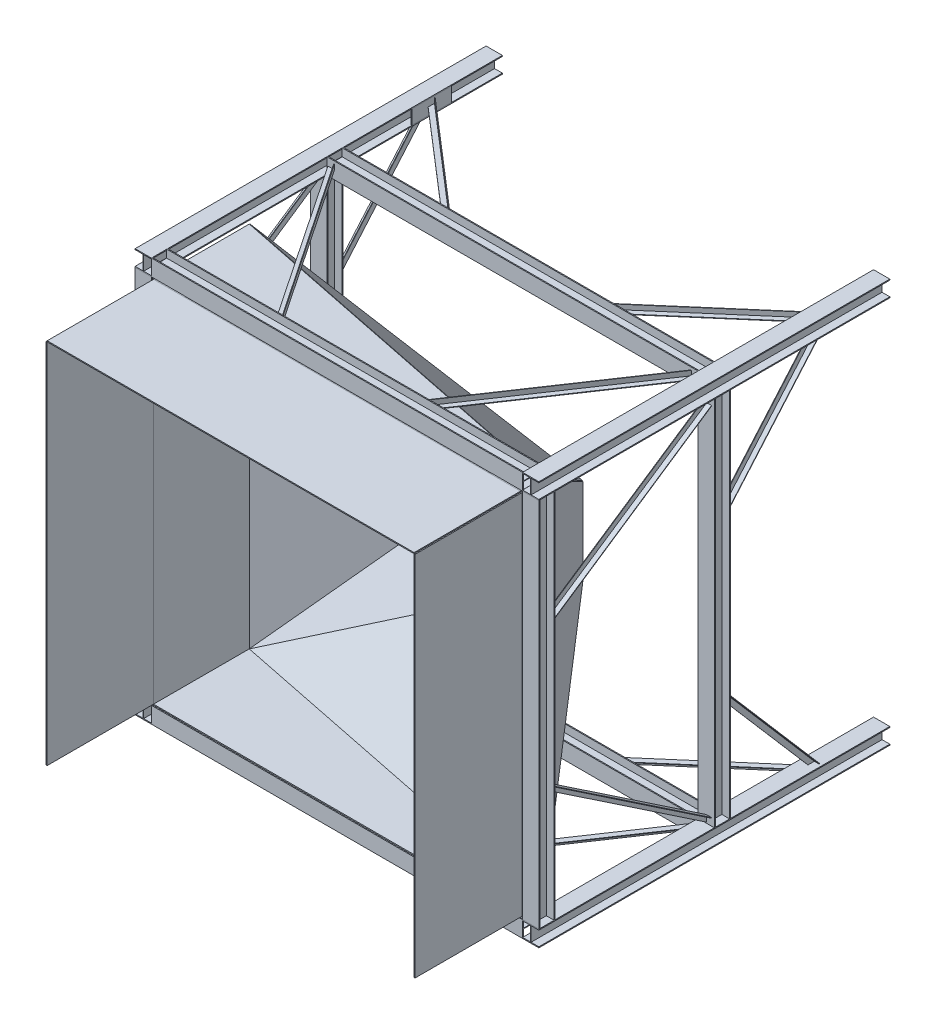
from build123d import *

# Parameters (mm, degrees)
COLUMNA_H_1_DEPTH                            = 3300
COLUMNA_H_2_DEPTH                            = 3300
COLUMNA_H_3_DEPTH                            = 3300
COLUMNA_H_4_DEPTH                            = 3300
VIGA_H_CARGA_1650_DEPTH                      = 3490
VIGA_H_CARGA_3300_DEPTH                      = 3490
CONTORNO_CIERRE_COLUMNA_CARGA_A_W            = 370
CONTORNO_CIERRE_COLUMNA_CARGA_A_H            = 135
CIERRE_COLUMNA_CARGA_A_DEPTH                 = 8
ALA_PLANA_ANGULAR_SUPERIOR_CARGA_A_DEPTH     = 5
RETORNO_ANGULAR_SUPERIOR_CARGA_A_DEPTH       = 45
ALA_PLANA_ANGULAR_INFERIOR_CARGA_A_DEPTH     = 5
RETORNO_ANGULAR_INFERIOR_CARGA_A_DEPTH       = 45
CONTORNO_CIERRE_COLUMNA_CARGA_B_W            = 370
CONTORNO_CIERRE_COLUMNA_CARGA_B_H            = 135
CIERRE_COLUMNA_CARGA_B_DEPTH                 = 8
ALA_PLANA_ANGULAR_SUPERIOR_CARGA_B_DEPTH     = 5
RETORNO_ANGULAR_SUPERIOR_CARGA_B_DEPTH       = 45
ALA_PLANA_ANGULAR_INFERIOR_CARGA_B_DEPTH     = 5
RETORNO_ANGULAR_INFERIOR_CARGA_B_DEPTH       = 45
CONTORNO_ASIENTO_SOLDADO_CARGA_W             = 2900
CONTORNO_ASIENTO_SOLDADO_CARGA_H             = 83.725
ASIENTO_SOLDADO_CARGA_DEPTH                  = 9.525
VIGA_H_FONDO_1650_DEPTH                      = 3490
VIGA_H_FONDO_3300_DEPTH                      = 3490
CONTORNO_CIERRE_COLUMNA_FONDO_A_W            = 370
CONTORNO_CIERRE_COLUMNA_FONDO_A_H            = 135
CIERRE_COLUMNA_FONDO_A_DEPTH                 = 8
ALA_PLANA_ANGULAR_SUPERIOR_FONDO_A_DEPTH     = 5
RETORNO_ANGULAR_SUPERIOR_FONDO_A_DEPTH       = 45
ALA_PLANA_ANGULAR_INFERIOR_FONDO_A_DEPTH     = 5
RETORNO_ANGULAR_INFERIOR_FONDO_A_DEPTH       = 45
CONTORNO_CIERRE_COLUMNA_FONDO_B_W            = 370
CONTORNO_CIERRE_COLUMNA_FONDO_B_H            = 135
CIERRE_COLUMNA_FONDO_B_DEPTH                 = 8
ALA_PLANA_ANGULAR_SUPERIOR_FONDO_B_DEPTH     = 5
RETORNO_ANGULAR_SUPERIOR_FONDO_B_DEPTH       = 45
ALA_PLANA_ANGULAR_INFERIOR_FONDO_B_DEPTH     = 5
RETORNO_ANGULAR_INFERIOR_FONDO_B_DEPTH       = 45
CONTORNO_ASIENTO_SOLDADO_FONDO_W             = 2900
CONTORNO_ASIENTO_SOLDADO_FONDO_H             = 83.725
ASIENTO_SOLDADO_FONDO_DEPTH                  = 9.525
VIGA_H_IZQUIERDA_1650_DEPTH                  = 3490
VIGA_H_IZQUIERDA_3300_DEPTH                  = 3490
ALA_PLANA_ANGULAR_SUPERIOR_IZQUIERDA_A_DEPTH = 5
RETORNO_ANGULAR_SUPERIOR_IZQUIERDA_A_DEPTH   = 45
ALA_PLANA_ANGULAR_INFERIOR_IZQUIERDA_A_DEPTH = 5
RETORNO_ANGULAR_INFERIOR_IZQUIERDA_A_DEPTH   = 45
ALA_PLANA_ANGULAR_SUPERIOR_IZQUIERDA_B_DEPTH = 5
RETORNO_ANGULAR_SUPERIOR_IZQUIERDA_B_DEPTH   = 45
ALA_PLANA_ANGULAR_INFERIOR_IZQUIERDA_B_DEPTH = 5
RETORNO_ANGULAR_INFERIOR_IZQUIERDA_B_DEPTH   = 45
CONTORNO_ASIENTO_SOLDADO_IZQUIERDA_W         = 83.725
CONTORNO_ASIENTO_SOLDADO_IZQUIERDA_H         = 2900
ASIENTO_SOLDADO_IZQUIERDA_DEPTH              = 9.525
VIGA_H_DERECHA_1650_DEPTH                    = 3490
VIGA_H_DERECHA_3300_DEPTH                    = 3490
ALA_PLANA_ANGULAR_SUPERIOR_DERECHA_A_DEPTH   = 5
RETORNO_ANGULAR_SUPERIOR_DERECHA_A_DEPTH     = 45
ALA_PLANA_ANGULAR_INFERIOR_DERECHA_A_DEPTH   = 5
RETORNO_ANGULAR_INFERIOR_DERECHA_A_DEPTH     = 45
ALA_PLANA_ANGULAR_SUPERIOR_DERECHA_B_DEPTH   = 5
RETORNO_ANGULAR_SUPERIOR_DERECHA_B_DEPTH     = 45
ALA_PLANA_ANGULAR_INFERIOR_DERECHA_B_DEPTH   = 5
RETORNO_ANGULAR_INFERIOR_DERECHA_B_DEPTH     = 45
CONTORNO_ASIENTO_SOLDADO_DERECHA_W           = 83.725
CONTORNO_ASIENTO_SOLDADO_DERECHA_H           = 2900
ASIENTO_SOLDADO_DERECHA_DEPTH                = 9.525
COLLAR_CARGA_DEPTH                           = 9.525
EMBUDO_CARGA_PA_O_SUPERIOR_DEPTH             = 9.525
EMBUDO_CARGA_PA_O_INFERIOR_DEPTH             = 9.525
CONTORNO_COLLAR_DERECHA_W                    = 200
CONTORNO_COLLAR_DERECHA_H                    = 3450
COLLAR_DERECHA_DEPTH                         = 9.525
CONTORNO_ALER_N_DERECHA_W                    = 1000
CONTORNO_ALER_N_DERECHA_H                    = 3450
ALER_N_DERECHA_DEPTH                         = 9.525
EMBUDO_DERECHA_DEPTH                         = 9.525
COLLAR_FONDO_DEPTH                           = 9.525
CONTORNO_ALER_N_FONDO_W                      = 3450
CONTORNO_ALER_N_FONDO_H                      = 1000
ALER_N_FONDO_DEPTH                           = 9.525
EMBUDO_FONDO_PA_O_SUPERIOR_DEPTH             = 9.525
EMBUDO_FONDO_PA_O_INFERIOR_DEPTH             = 9.525
CONTORNO_COLLAR_IZQUIERDA_W                  = 900
CONTORNO_COLLAR_IZQUIERDA_H                  = 3450
COLLAR_IZQUIERDA_DEPTH                       = 9.525
CONTORNO_ALER_N_IZQUIERDA_W                  = 1000
CONTORNO_ALER_N_IZQUIERDA_H                  = 3450
ALER_N_IZQUIERDA_DEPTH                       = 9.525
EMBUDO_IZQUIERDA_DEPTH                       = 9.525


with BuildPart() as part:
    # Contorno Columna H 1 → Columna H 1 (new body)
    with BuildSketch(Plane.XY):
        Polygon((-1898, -1898), (-1745, -1898), (-1745, -1889), (-1818.25, -1889), (-1818.25, -1754), (-1745, -1754), (-1745, -1745), (-1898, -1745), (-1898, -1754), (-1824.75, -1754), (-1824.75, -1889), (-1898, -1889), align=None)
    extrude(amount=COLUMNA_H_1_DEPTH)


with BuildPart() as body_2:
    # Contorno Columna H 2 → Columna H 2 (new body)
    with BuildSketch(Plane.XY):
        Polygon((-1898, 1745), (-1745, 1745), (-1745, 1754), (-1818.25, 1754), (-1818.25, 1889), (-1745, 1889), (-1745, 1898), (-1898, 1898), (-1898, 1889), (-1824.75, 1889), (-1824.75, 1754), (-1898, 1754), align=None)
    extrude(amount=COLUMNA_H_2_DEPTH)


with BuildPart() as body_3:
    # Contorno Columna H 3 → Columna H 3 (new body)
    with BuildSketch(Plane.XY):
        Polygon((1745, -1898), (1898, -1898), (1898, -1889), (1824.75, -1889), (1824.75, -1754), (1898, -1754), (1898, -1745), (1745, -1745), (1745, -1754), (1818.25, -1754), (1818.25, -1889), (1745, -1889), align=None)
    extrude(amount=COLUMNA_H_3_DEPTH)


with BuildPart() as body_4:
    # Contorno Columna H 4 → Columna H 4 (new body)
    with BuildSketch(Plane.XY):
        Polygon((1745, 1745), (1898, 1745), (1898, 1754), (1824.75, 1754), (1824.75, 1889), (1898, 1889), (1898, 1898), (1745, 1898), (1745, 1889), (1818.25, 1889), (1818.25, 1754), (1745, 1754), align=None)
    extrude(amount=COLUMNA_H_4_DEPTH)


with BuildPart() as body_5:
    # Contorno Viga H carga 1650 → Viga H carga 1650 (new body)
    with BuildSketch(Plane(origin=(-1745, 0, 0), x_dir=(0, 0, -1), z_dir=(1, 0, 0))):
        Polygon((-1497, -1745), (-1497, -1898), (-1506, -1898), (-1506, -1824.75), (-1641, -1824.75), (-1641, -1898), (-1650, -1898), (-1650, -1745), (-1641, -1745), (-1641, -1818.25), (-1506, -1818.25), (-1506, -1745), align=None)
    extrude(amount=VIGA_H_CARGA_1650_DEPTH)


with BuildPart() as body_6:
    # Contorno Viga H carga 3300 → Viga H carga 3300 (new body)
    with BuildSketch(Plane(origin=(-1745, 0, 0), x_dir=(0, 0, -1), z_dir=(1, 0, 0))):
        Polygon((-3147, -1745), (-3147, -1898), (-3156, -1898), (-3156, -1824.75), (-3291, -1824.75), (-3291, -1898), (-3300, -1898), (-3300, -1745), (-3291, -1745), (-3291, -1818.25), (-3156, -1818.25), (-3156, -1745), align=None)
    extrude(amount=VIGA_H_CARGA_3300_DEPTH)


with BuildPart() as body_7:
    # Contorno Cierre columna carga A → Cierre columna carga A (new body)
    with BuildSketch(Plane(origin=(-1745, 0, 0), x_dir=(0, 0, -1), z_dir=(1, 0, 0))):
        with Locations((-665, -1821.5)):
            Rectangle(CONTORNO_CIERRE_COLUMNA_CARGA_A_W, CONTORNO_CIERRE_COLUMNA_CARGA_A_H)
    extrude(amount=-CIERRE_COLUMNA_CARGA_A_DEPTH)


with BuildPart() as body_8:
    # Contorno Ala plana Angular superior carg → Ala plana Angular superior carga A (new body)
    with BuildSketch(Plane(origin=(0, -1821.5, 0), x_dir=(1, 0, 0), z_dir=(0, 1, 0))):
        Polygon((-1674.870108064, -1650), (-1735.129891936, -1650), (-728.129891936, -3147), (-667.870108064, -3147), align=None)
    extrude(amount=-ALA_PLANA_ANGULAR_SUPERIOR_CARGA_A_DEPTH)


with BuildPart() as body_9:
    # Contorno Retorno Angular superior carga → Retorno Angular superior carga A (new body)
    with BuildSketch(Plane(origin=(0, -1826.5, 0), x_dir=(1, 0, 0), z_dir=(0, 1, 0))):
        Polygon((-1674.870108064, -1650), (-1680.896086451, -1650), (-673.896086451, -3147), (-667.870108064, -3147), align=None)
    extrude(amount=-RETORNO_ANGULAR_SUPERIOR_CARGA_A_DEPTH)


with BuildPart() as body_8_1:
    add(body_8.part)

    # Angular superior carga A: union body 9
    add(body_9.part)


with BuildPart() as body_9_2:
    # Contorno Ala plana Angular inferior carg → Ala plana Angular inferior carga A (new body)
    with BuildSketch(Plane(origin=(0, -1821.5, 0), x_dir=(1, 0, 0), z_dir=(0, 1, 0))):
        Polygon((-1745, -631.991026401), (-1745, -698.008973599), (-818.285648465, -1497), (-741.714351535, -1497), align=None)
    extrude(amount=-ALA_PLANA_ANGULAR_INFERIOR_CARGA_A_DEPTH)


with BuildPart() as body_10:
    # Contorno Retorno Angular inferior carga → Retorno Angular inferior carga A (new body)
    with BuildSketch(Plane(origin=(0, -1826.5, 0), x_dir=(1, 0, 0), z_dir=(0, 1, 0))):
        Polygon((-1745, -631.991026401), (-1745, -638.592821121), (-749.371481228, -1497), (-741.714351535, -1497), align=None)
    extrude(amount=-RETORNO_ANGULAR_INFERIOR_CARGA_A_DEPTH)


with BuildPart() as body_9_2_1:
    add(body_9_2.part)

    # Angular inferior carga A: union body 10
    add(body_10.part)


with BuildPart() as body_10_2:
    # Contorno Cierre columna carga B → Cierre columna carga B (new body)
    with BuildSketch(Plane(origin=(1745, 0, 0), x_dir=(0, 0, -1), z_dir=(1, 0, 0))):
        with Locations((-665, -1821.5)):
            Rectangle(CONTORNO_CIERRE_COLUMNA_CARGA_B_W, CONTORNO_CIERRE_COLUMNA_CARGA_B_H)
    extrude(amount=CIERRE_COLUMNA_CARGA_B_DEPTH)


with BuildPart() as body_11:
    # Contorno Ala plana Angular superior  2 → Ala plana Angular superior carga B (new body)
    with BuildSketch(Plane(origin=(0, -1821.5, 0), x_dir=(1, 0, 0), z_dir=(0, 1, 0))):
        Polygon((1674.870108064, -1650), (1735.129891936, -1650), (728.129891936, -3147), (667.870108064, -3147), align=None)
    extrude(amount=-ALA_PLANA_ANGULAR_SUPERIOR_CARGA_B_DEPTH)


with BuildPart() as body_12:
    # Contorno Retorno Angular superior ca 2 → Retorno Angular superior carga B (new body)
    with BuildSketch(Plane(origin=(0, -1826.5, 0), x_dir=(1, 0, 0), z_dir=(0, 1, 0))):
        Polygon((1674.870108064, -1650), (1680.896086451, -1650), (673.896086451, -3147), (667.870108064, -3147), align=None)
    extrude(amount=-RETORNO_ANGULAR_SUPERIOR_CARGA_B_DEPTH)


with BuildPart() as body_11_1:
    add(body_11.part)

    # Angular superior carga B: union body 12
    add(body_12.part)


with BuildPart() as body_12_2:
    # Contorno Ala plana Angular inferior  2 → Ala plana Angular inferior carga B (new body)
    with BuildSketch(Plane(origin=(0, -1821.5, 0), x_dir=(1, 0, 0), z_dir=(0, 1, 0))):
        Polygon((1745, -631.991026401), (1745, -698.008973599), (818.285648465, -1497), (741.714351535, -1497), align=None)
    extrude(amount=-ALA_PLANA_ANGULAR_INFERIOR_CARGA_B_DEPTH)


with BuildPart() as body_13:
    # Contorno Retorno Angular inferior ca 2 → Retorno Angular inferior carga B (new body)
    with BuildSketch(Plane(origin=(0, -1826.5, 0), x_dir=(1, 0, 0), z_dir=(0, 1, 0))):
        Polygon((1745, -631.991026401), (1745, -638.592821121), (749.371481228, -1497), (741.714351535, -1497), align=None)
    extrude(amount=-RETORNO_ANGULAR_INFERIOR_CARGA_B_DEPTH)


with BuildPart() as body_12_2_1:
    add(body_12_2.part)

    # Angular inferior carga B: union body 13
    add(body_13.part)


with BuildPart() as body_13_2:
    # Contorno Asiento soldado carga → Asiento soldado carga (new body)
    with BuildSketch(Plane.XY.offset(3281.475)):
        with Locations((0, -1776.3875)):
            Rectangle(CONTORNO_ASIENTO_SOLDADO_CARGA_W, CONTORNO_ASIENTO_SOLDADO_CARGA_H)
    extrude(amount=ASIENTO_SOLDADO_CARGA_DEPTH)


with BuildPart() as body_14:
    # Contorno Viga H fondo 1650 → Viga H fondo 1650 (new body)
    with BuildSketch(Plane(origin=(-1745, 0, 0), x_dir=(0, 0, -1), z_dir=(1, 0, 0))):
        Polygon((-1497, 1745), (-1497, 1898), (-1506, 1898), (-1506, 1824.75), (-1641, 1824.75), (-1641, 1898), (-1650, 1898), (-1650, 1745), (-1641, 1745), (-1641, 1818.25), (-1506, 1818.25), (-1506, 1745), align=None)
    extrude(amount=VIGA_H_FONDO_1650_DEPTH)


with BuildPart() as body_15:
    # Contorno Viga H fondo 3300 → Viga H fondo 3300 (new body)
    with BuildSketch(Plane(origin=(-1745, 0, 0), x_dir=(0, 0, -1), z_dir=(1, 0, 0))):
        Polygon((-3147, 1745), (-3147, 1898), (-3156, 1898), (-3156, 1824.75), (-3291, 1824.75), (-3291, 1898), (-3300, 1898), (-3300, 1745), (-3291, 1745), (-3291, 1818.25), (-3156, 1818.25), (-3156, 1745), align=None)
    extrude(amount=VIGA_H_FONDO_3300_DEPTH)


with BuildPart() as body_16:
    # Contorno Cierre columna fondo A → Cierre columna fondo A (new body)
    with BuildSketch(Plane(origin=(-1745, 0, 0), x_dir=(0, 0, -1), z_dir=(1, 0, 0))):
        with Locations((-665, 1821.5)):
            Rectangle(CONTORNO_CIERRE_COLUMNA_FONDO_A_W, CONTORNO_CIERRE_COLUMNA_FONDO_A_H)
    extrude(amount=-CIERRE_COLUMNA_FONDO_A_DEPTH)


with BuildPart() as body_17:
    # Contorno Ala plana Angular superior fond → Ala plana Angular superior fondo A (new body)
    with BuildSketch(Plane(origin=(0, 1821.5, 0), x_dir=(1, 0, 0), z_dir=(0, 1, 0))):
        Polygon((-1674.870108064, -1650), (-1735.129891936, -1650), (-728.129891936, -3147), (-667.870108064, -3147), align=None)
    extrude(amount=ALA_PLANA_ANGULAR_SUPERIOR_FONDO_A_DEPTH)


with BuildPart() as body_18:
    # Contorno Retorno Angular superior fondo → Retorno Angular superior fondo A (new body)
    with BuildSketch(Plane(origin=(0, 1826.5, 0), x_dir=(1, 0, 0), z_dir=(0, 1, 0))):
        Polygon((-1674.870108064, -1650), (-1680.896086451, -1650), (-673.896086451, -3147), (-667.870108064, -3147), align=None)
    extrude(amount=RETORNO_ANGULAR_SUPERIOR_FONDO_A_DEPTH)


with BuildPart() as body_17_1:
    add(body_17.part)

    # Angular superior fondo A: union body 18
    add(body_18.part)


with BuildPart() as body_18_2:
    # Contorno Ala plana Angular inferior fond → Ala plana Angular inferior fondo A (new body)
    with BuildSketch(Plane(origin=(0, 1821.5, 0), x_dir=(1, 0, 0), z_dir=(0, 1, 0))):
        Polygon((-1745, -631.991026401), (-1745, -698.008973599), (-818.285648465, -1497), (-741.714351535, -1497), align=None)
    extrude(amount=ALA_PLANA_ANGULAR_INFERIOR_FONDO_A_DEPTH)


with BuildPart() as body_19:
    # Contorno Retorno Angular inferior fondo → Retorno Angular inferior fondo A (new body)
    with BuildSketch(Plane(origin=(0, 1826.5, 0), x_dir=(1, 0, 0), z_dir=(0, 1, 0))):
        Polygon((-1745, -631.991026401), (-1745, -638.592821121), (-749.371481228, -1497), (-741.714351535, -1497), align=None)
    extrude(amount=RETORNO_ANGULAR_INFERIOR_FONDO_A_DEPTH)


with BuildPart() as body_18_2_1:
    add(body_18_2.part)

    # Angular inferior fondo A: union body 19
    add(body_19.part)


with BuildPart() as body_19_2:
    # Contorno Cierre columna fondo B → Cierre columna fondo B (new body)
    with BuildSketch(Plane(origin=(1745, 0, 0), x_dir=(0, 0, -1), z_dir=(1, 0, 0))):
        with Locations((-665, 1821.5)):
            Rectangle(CONTORNO_CIERRE_COLUMNA_FONDO_B_W, CONTORNO_CIERRE_COLUMNA_FONDO_B_H)
    extrude(amount=CIERRE_COLUMNA_FONDO_B_DEPTH)


with BuildPart() as body_20:
    # Contorno Ala plana Angular superior  3 → Ala plana Angular superior fondo B (new body)
    with BuildSketch(Plane(origin=(0, 1821.5, 0), x_dir=(1, 0, 0), z_dir=(0, 1, 0))):
        Polygon((1674.870108064, -1650), (1735.129891936, -1650), (728.129891936, -3147), (667.870108064, -3147), align=None)
    extrude(amount=ALA_PLANA_ANGULAR_SUPERIOR_FONDO_B_DEPTH)


with BuildPart() as body_21:
    # Contorno Retorno Angular superior fo 2 → Retorno Angular superior fondo B (new body)
    with BuildSketch(Plane(origin=(0, 1826.5, 0), x_dir=(1, 0, 0), z_dir=(0, 1, 0))):
        Polygon((1674.870108064, -1650), (1680.896086451, -1650), (673.896086451, -3147), (667.870108064, -3147), align=None)
    extrude(amount=RETORNO_ANGULAR_SUPERIOR_FONDO_B_DEPTH)


with BuildPart() as body_20_1:
    add(body_20.part)

    # Angular superior fondo B: union body 21
    add(body_21.part)


with BuildPart() as body_21_2:
    # Contorno Ala plana Angular inferior  3 → Ala plana Angular inferior fondo B (new body)
    with BuildSketch(Plane(origin=(0, 1821.5, 0), x_dir=(1, 0, 0), z_dir=(0, 1, 0))):
        Polygon((1745, -631.991026401), (1745, -698.008973599), (818.285648465, -1497), (741.714351535, -1497), align=None)
    extrude(amount=ALA_PLANA_ANGULAR_INFERIOR_FONDO_B_DEPTH)


with BuildPart() as body_22:
    # Contorno Retorno Angular inferior fo 2 → Retorno Angular inferior fondo B (new body)
    with BuildSketch(Plane(origin=(0, 1826.5, 0), x_dir=(1, 0, 0), z_dir=(0, 1, 0))):
        Polygon((1745, -631.991026401), (1745, -638.592821121), (749.371481228, -1497), (741.714351535, -1497), align=None)
    extrude(amount=RETORNO_ANGULAR_INFERIOR_FONDO_B_DEPTH)


with BuildPart() as body_21_2_1:
    add(body_21_2.part)

    # Angular inferior fondo B: union body 22
    add(body_22.part)


with BuildPart() as body_22_2:
    # Contorno Asiento soldado fondo → Asiento soldado fondo (new body)
    with BuildSketch(Plane.XY.offset(3281.475)):
        with Locations((0, 1776.3875)):
            Rectangle(CONTORNO_ASIENTO_SOLDADO_FONDO_W, CONTORNO_ASIENTO_SOLDADO_FONDO_H)
    extrude(amount=ASIENTO_SOLDADO_FONDO_DEPTH)


with BuildPart() as body_23:
    # Contorno Viga H izquierda 1650 → Viga H izquierda 1650 (new body)
    with BuildSketch(Plane(origin=(0, -1745, 0), x_dir=(1, 0, 0), z_dir=(0, 1, 0))):
        Polygon((-1745, -1497), (-1898, -1497), (-1898, -1506), (-1824.75, -1506), (-1824.75, -1641), (-1898, -1641), (-1898, -1650), (-1745, -1650), (-1745, -1641), (-1818.25, -1641), (-1818.25, -1506), (-1745, -1506), align=None)
    extrude(amount=VIGA_H_IZQUIERDA_1650_DEPTH)


with BuildPart() as body_24:
    # Contorno Viga H izquierda 3300 → Viga H izquierda 3300 (new body)
    with BuildSketch(Plane(origin=(0, -1745, 0), x_dir=(1, 0, 0), z_dir=(0, 1, 0))):
        Polygon((-1745, -3147), (-1898, -3147), (-1898, -3156), (-1824.75, -3156), (-1824.75, -3291), (-1898, -3291), (-1898, -3300), (-1745, -3300), (-1745, -3291), (-1818.25, -3291), (-1818.25, -3156), (-1745, -3156), align=None)
    extrude(amount=VIGA_H_IZQUIERDA_3300_DEPTH)


with BuildPart() as body_25:
    # Contorno Ala plana Angular superior izqu → Ala plana Angular superior izquierda A (new body)
    with BuildSketch(Plane(origin=(-1821.5, 0, 0), x_dir=(0, 0, -1), z_dir=(1, 0, 0))):
        Polygon((-1650, -1674.870108064), (-1650, -1735.129891936), (-3147, -728.129891936), (-3147, -667.870108064), align=None)
    extrude(amount=-ALA_PLANA_ANGULAR_SUPERIOR_IZQUIERDA_A_DEPTH)


with BuildPart() as body_26:
    # Contorno Retorno Angular superior izquie → Retorno Angular superior izquierda A (new body)
    with BuildSketch(Plane(origin=(-1826.5, 0, 0), x_dir=(0, 0, -1), z_dir=(1, 0, 0))):
        Polygon((-1650, -1674.870108064), (-1650, -1680.896086451), (-3147, -673.896086451), (-3147, -667.870108064), align=None)
    extrude(amount=-RETORNO_ANGULAR_SUPERIOR_IZQUIERDA_A_DEPTH)


with BuildPart() as body_25_1:
    add(body_25.part)

    # Angular superior izquierda A: union body 26
    add(body_26.part)


with BuildPart() as body_26_2:
    # Contorno Ala plana Angular inferior izqu → Ala plana Angular inferior izquierda A (new body)
    with BuildSketch(Plane(origin=(-1821.5, 0, 0), x_dir=(0, 0, -1), z_dir=(1, 0, 0))):
        Polygon((-631.991026401, -1745), (-698.008973599, -1745), (-1497, -818.285648465), (-1497, -741.714351535), align=None)
    extrude(amount=-ALA_PLANA_ANGULAR_INFERIOR_IZQUIERDA_A_DEPTH)


with BuildPart() as body_27:
    # Contorno Retorno Angular inferior izquie → Retorno Angular inferior izquierda A (new body)
    with BuildSketch(Plane(origin=(-1826.5, 0, 0), x_dir=(0, 0, -1), z_dir=(1, 0, 0))):
        Polygon((-631.991026401, -1745), (-638.592821121, -1745), (-1497, -749.371481228), (-1497, -741.714351535), align=None)
    extrude(amount=-RETORNO_ANGULAR_INFERIOR_IZQUIERDA_A_DEPTH)


with BuildPart() as body_26_2_1:
    add(body_26_2.part)

    # Angular inferior izquierda A: union body 27
    add(body_27.part)


with BuildPart() as body_27_2:
    # Contorno Ala plana Angular superior  4 → Ala plana Angular superior izquierda B (new body)
    with BuildSketch(Plane(origin=(-1821.5, 0, 0), x_dir=(0, 0, -1), z_dir=(1, 0, 0))):
        Polygon((-1650, 1674.870108064), (-1650, 1735.129891936), (-3147, 728.129891936), (-3147, 667.870108064), align=None)
    extrude(amount=-ALA_PLANA_ANGULAR_SUPERIOR_IZQUIERDA_B_DEPTH)


with BuildPart() as body_28:
    # Contorno Retorno Angular superior iz 2 → Retorno Angular superior izquierda B (new body)
    with BuildSketch(Plane(origin=(-1826.5, 0, 0), x_dir=(0, 0, -1), z_dir=(1, 0, 0))):
        Polygon((-1650, 1674.870108064), (-1650, 1680.896086451), (-3147, 673.896086451), (-3147, 667.870108064), align=None)
    extrude(amount=-RETORNO_ANGULAR_SUPERIOR_IZQUIERDA_B_DEPTH)


with BuildPart() as body_27_2_1:
    add(body_27_2.part)

    # Angular superior izquierda B: union body 28
    add(body_28.part)


with BuildPart() as body_28_2:
    # Contorno Ala plana Angular inferior  4 → Ala plana Angular inferior izquierda B (new body)
    with BuildSketch(Plane(origin=(-1821.5, 0, 0), x_dir=(0, 0, -1), z_dir=(1, 0, 0))):
        Polygon((-631.991026401, 1745), (-698.008973599, 1745), (-1497, 818.285648465), (-1497, 741.714351535), align=None)
    extrude(amount=-ALA_PLANA_ANGULAR_INFERIOR_IZQUIERDA_B_DEPTH)


with BuildPart() as body_29:
    # Contorno Retorno Angular inferior iz 2 → Retorno Angular inferior izquierda B (new body)
    with BuildSketch(Plane(origin=(-1826.5, 0, 0), x_dir=(0, 0, -1), z_dir=(1, 0, 0))):
        Polygon((-631.991026401, 1745), (-638.592821121, 1745), (-1497, 749.371481228), (-1497, 741.714351535), align=None)
    extrude(amount=-RETORNO_ANGULAR_INFERIOR_IZQUIERDA_B_DEPTH)


with BuildPart() as body_28_2_1:
    add(body_28_2.part)

    # Angular inferior izquierda B: union body 29
    add(body_29.part)


with BuildPart() as body_29_2:
    # Contorno Asiento soldado izquierda → Asiento soldado izquierda (new body)
    with BuildSketch(Plane.XY.offset(3281.475)):
        with Locations((-1776.3875, 0)):
            Rectangle(CONTORNO_ASIENTO_SOLDADO_IZQUIERDA_W, CONTORNO_ASIENTO_SOLDADO_IZQUIERDA_H)
    extrude(amount=ASIENTO_SOLDADO_IZQUIERDA_DEPTH)


with BuildPart() as body_30:
    # Contorno Viga H derecha 1650 → Viga H derecha 1650 (new body)
    with BuildSketch(Plane(origin=(0, -1745, 0), x_dir=(1, 0, 0), z_dir=(0, 1, 0))):
        Polygon((1745, -1497), (1898, -1497), (1898, -1506), (1824.75, -1506), (1824.75, -1641), (1898, -1641), (1898, -1650), (1745, -1650), (1745, -1641), (1818.25, -1641), (1818.25, -1506), (1745, -1506), align=None)
    extrude(amount=VIGA_H_DERECHA_1650_DEPTH)


with BuildPart() as body_31:
    # Contorno Viga H derecha 3300 → Viga H derecha 3300 (new body)
    with BuildSketch(Plane(origin=(0, -1745, 0), x_dir=(1, 0, 0), z_dir=(0, 1, 0))):
        Polygon((1745, -3147), (1898, -3147), (1898, -3156), (1824.75, -3156), (1824.75, -3291), (1898, -3291), (1898, -3300), (1745, -3300), (1745, -3291), (1818.25, -3291), (1818.25, -3156), (1745, -3156), align=None)
    extrude(amount=VIGA_H_DERECHA_3300_DEPTH)


with BuildPart() as body_32:
    # Contorno Ala plana Angular superior dere → Ala plana Angular superior derecha A (new body)
    with BuildSketch(Plane(origin=(1821.5, 0, 0), x_dir=(0, 0, -1), z_dir=(1, 0, 0))):
        Polygon((-1650, -1674.870108064), (-1650, -1735.129891936), (-3147, -728.129891936), (-3147, -667.870108064), align=None)
    extrude(amount=ALA_PLANA_ANGULAR_SUPERIOR_DERECHA_A_DEPTH)


with BuildPart() as body_33:
    # Contorno Retorno Angular superior derech → Retorno Angular superior derecha A (new body)
    with BuildSketch(Plane(origin=(1826.5, 0, 0), x_dir=(0, 0, -1), z_dir=(1, 0, 0))):
        Polygon((-1650, -1674.870108064), (-1650, -1680.896086451), (-3147, -673.896086451), (-3147, -667.870108064), align=None)
    extrude(amount=RETORNO_ANGULAR_SUPERIOR_DERECHA_A_DEPTH)


with BuildPart() as body_32_1:
    add(body_32.part)

    # Angular superior derecha A: union body 33
    add(body_33.part)


with BuildPart() as body_33_2:
    # Contorno Ala plana Angular inferior dere → Ala plana Angular inferior derecha A (new body)
    with BuildSketch(Plane(origin=(1821.5, 0, 0), x_dir=(0, 0, -1), z_dir=(1, 0, 0))):
        Polygon((-631.991026401, -1745), (-698.008973599, -1745), (-1497, -818.285648465), (-1497, -741.714351535), align=None)
    extrude(amount=ALA_PLANA_ANGULAR_INFERIOR_DERECHA_A_DEPTH)


with BuildPart() as body_34:
    # Contorno Retorno Angular inferior derech → Retorno Angular inferior derecha A (new body)
    with BuildSketch(Plane(origin=(1826.5, 0, 0), x_dir=(0, 0, -1), z_dir=(1, 0, 0))):
        Polygon((-631.991026401, -1745), (-638.592821121, -1745), (-1497, -749.371481228), (-1497, -741.714351535), align=None)
    extrude(amount=RETORNO_ANGULAR_INFERIOR_DERECHA_A_DEPTH)


with BuildPart() as body_33_2_1:
    add(body_33_2.part)

    # Angular inferior derecha A: union body 34
    add(body_34.part)


with BuildPart() as body_34_2:
    # Contorno Ala plana Angular superior  5 → Ala plana Angular superior derecha B (new body)
    with BuildSketch(Plane(origin=(1821.5, 0, 0), x_dir=(0, 0, -1), z_dir=(1, 0, 0))):
        Polygon((-1650, 1674.870108064), (-1650, 1735.129891936), (-3147, 728.129891936), (-3147, 667.870108064), align=None)
    extrude(amount=ALA_PLANA_ANGULAR_SUPERIOR_DERECHA_B_DEPTH)


with BuildPart() as body_35:
    # Contorno Retorno Angular superior de 2 → Retorno Angular superior derecha B (new body)
    with BuildSketch(Plane(origin=(1826.5, 0, 0), x_dir=(0, 0, -1), z_dir=(1, 0, 0))):
        Polygon((-1650, 1674.870108064), (-1650, 1680.896086451), (-3147, 673.896086451), (-3147, 667.870108064), align=None)
    extrude(amount=RETORNO_ANGULAR_SUPERIOR_DERECHA_B_DEPTH)


with BuildPart() as body_34_2_1:
    add(body_34_2.part)

    # Angular superior derecha B: union body 35
    add(body_35.part)


with BuildPart() as body_35_2:
    # Contorno Ala plana Angular inferior  5 → Ala plana Angular inferior derecha B (new body)
    with BuildSketch(Plane(origin=(1821.5, 0, 0), x_dir=(0, 0, -1), z_dir=(1, 0, 0))):
        Polygon((-631.991026401, 1745), (-698.008973599, 1745), (-1497, 818.285648465), (-1497, 741.714351535), align=None)
    extrude(amount=ALA_PLANA_ANGULAR_INFERIOR_DERECHA_B_DEPTH)


with BuildPart() as body_36:
    # Contorno Retorno Angular inferior de 2 → Retorno Angular inferior derecha B (new body)
    with BuildSketch(Plane(origin=(1826.5, 0, 0), x_dir=(0, 0, -1), z_dir=(1, 0, 0))):
        Polygon((-631.991026401, 1745), (-638.592821121, 1745), (-1497, 749.371481228), (-1497, 741.714351535), align=None)
    extrude(amount=RETORNO_ANGULAR_INFERIOR_DERECHA_B_DEPTH)


with BuildPart() as body_35_2_1:
    add(body_35_2.part)

    # Angular inferior derecha B: union body 36
    add(body_36.part)


with BuildPart() as body_36_2:
    # Contorno Asiento soldado derecha → Asiento soldado derecha (new body)
    with BuildSketch(Plane.XY.offset(3281.475)):
        with Locations((1776.3875, 0)):
            Rectangle(CONTORNO_ASIENTO_SOLDADO_DERECHA_W, CONTORNO_ASIENTO_SOLDADO_DERECHA_H)
    extrude(amount=ASIENTO_SOLDADO_DERECHA_DEPTH)


with BuildPart() as body_37:
    # Contorno Collar carga → Collar carga (new body)
    with BuildSketch(Plane(origin=(0, -1725, 0), x_dir=(1, 0, 0), z_dir=(0, 1, 0))):
        Polygon((-1725, -3300), (1725, -3300), (1725, -3100), (-1725, -2400), align=None)
    extrude(amount=-COLLAR_CARGA_DEPTH)


with BuildPart() as body_38:
    # Contorno Embudo carga paño superior → Embudo carga paño superior (new body)
    with BuildSketch(Plane(origin=(-113.147713183, 535.240530015, 557.6565864), x_dir=(-0.9894551977782576, -0.10029509147137895, -0.1044954841911205), z_dir=(0.14483926121597343, -0.6851560739461808, -0.7138506445644401))):
        Polygon((1629.030086897, -2906.414505479), (-1857.737184372, -3391.135039405), (-720.747856784, -1396.515960745), align=None)
    extrude(amount=EMBUDO_CARGA_PA_O_SUPERIOR_DEPTH)


with BuildPart() as body_39:
    # Contorno Embudo carga paño inferior → Embudo carga paño inferior (new body)
    with BuildSketch(Plane(origin=(0, 601.095747456, 995.564831724), x_dir=(1, 0, 0), z_dir=(0, 0.5168690990339176, 0.8560644452749256))):
        Polygon((-1725, -2717.197005781), (600, -1169.416336564), (-600, -1169.416336564), align=None)
    extrude(amount=-EMBUDO_CARGA_PA_O_INFERIOR_DEPTH)


with BuildPart() as body_40:
    # Contorno Collar derecha → Collar derecha (new body)
    with BuildSketch(Plane(origin=(1725, 0, 0), x_dir=(0, 0, -1), z_dir=(1, 0, 0))):
        with Locations((-3200, 0)):
            Rectangle(CONTORNO_COLLAR_DERECHA_W, CONTORNO_COLLAR_DERECHA_H)
    extrude(amount=COLLAR_DERECHA_DEPTH)


with BuildPart() as body_41:
    # Contorno Alerón derecha → Alerón derecha (new body)
    with BuildSketch(Plane(origin=(1725, 0, 0), x_dir=(0, 0, -1), z_dir=(1, 0, 0))):
        with Locations((-3800, 0)):
            Rectangle(CONTORNO_ALER_N_DERECHA_W, CONTORNO_ALER_N_DERECHA_H)
    extrude(amount=ALER_N_DERECHA_DEPTH)


with BuildPart() as body_42:
    # Contorno Embudo derecha → Embudo derecha (new body)
    with BuildSketch(Plane(origin=(-384, 0, 288), x_dir=(-0.6000000000000002, 0, -0.7999999999999999), z_dir=(0.7999999999999998, 0, -0.6000000000000001))):
        Polygon((-3515, -1725), (-3515, 1725), (-1640, 400), (-1640, -400), align=None)
    extrude(amount=EMBUDO_DERECHA_DEPTH)


with BuildPart() as body_43:
    # Contorno Collar fondo → Collar fondo (new body)
    with BuildSketch(Plane(origin=(0, 1725, 0), x_dir=(1, 0, 0), z_dir=(0, 1, 0))):
        Polygon((1725, -3300), (-1725, -3300), (-1725, -2400), (1725, -3100), align=None)
    extrude(amount=COLLAR_FONDO_DEPTH)


with BuildPart() as body_44:
    # Contorno Alerón fondo → Alerón fondo (new body)
    with BuildSketch(Plane(origin=(0, 1725, 0), x_dir=(1, 0, 0), z_dir=(0, 1, 0))):
        with Locations((0, -3800)):
            Rectangle(CONTORNO_ALER_N_FONDO_W, CONTORNO_ALER_N_FONDO_H)
    extrude(amount=ALER_N_FONDO_DEPTH)


with BuildPart() as body_45:
    # Contorno Embudo fondo paño superior → Embudo fondo paño superior (new body)
    with BuildSketch(Plane(origin=(-113.147713183, -535.240530015, 557.6565864), x_dir=(-0.9894551977782579, 0.10029509147137876, -0.1044954841911203), z_dir=(0.14483926121597315, 0.685156073946181, -0.7138506445644401))):
        Polygon((1629.030086897, 2906.414505479), (-1857.737184372, 3391.135039405), (-720.747856784, 1396.515960745), align=None)
    extrude(amount=EMBUDO_FONDO_PA_O_SUPERIOR_DEPTH)


with BuildPart() as body_46:
    # Contorno Embudo fondo paño inferior → Embudo fondo paño inferior (new body)
    with BuildSketch(Plane(origin=(0, -601.095747456, 995.564831724), x_dir=(-1, 0, 0), z_dir=(0, 0.5168690990339176, -0.8560644452749256))):
        Polygon((1725, 2717.197005781), (-600, 1169.416336564), (600, 1169.416336564), align=None)
    extrude(amount=EMBUDO_FONDO_PA_O_INFERIOR_DEPTH)


with BuildPart() as body_47:
    # Contorno Collar izquierda → Collar izquierda (new body)
    with BuildSketch(Plane(origin=(-1725, 0, 0), x_dir=(0, 0, -1), z_dir=(1, 0, 0))):
        with Locations((-2850, 0)):
            Rectangle(CONTORNO_COLLAR_IZQUIERDA_W, CONTORNO_COLLAR_IZQUIERDA_H)
    extrude(amount=-COLLAR_IZQUIERDA_DEPTH)


with BuildPart() as body_48:
    # Contorno Alerón izquierda → Alerón izquierda (new body)
    with BuildSketch(Plane(origin=(-1725, 0, 0), x_dir=(0, 0, -1), z_dir=(1, 0, 0))):
        with Locations((-3800, 0)):
            Rectangle(CONTORNO_ALER_N_IZQUIERDA_W, CONTORNO_ALER_N_IZQUIERDA_H)
    extrude(amount=-ALER_N_IZQUIERDA_DEPTH)


with BuildPart() as body_49:
    # Contorno Embudo izquierda → Embudo izquierda (new body)
    with BuildSketch(Plane(origin=(554.148901279, 0, 779.271892424), x_dir=(0.8149553245687554, 0, -0.5795237863600032), z_dir=(0.5795237863600031, 0, 0.8149553245687553))):
        Polygon((-2796.655022145, 1725), (-2796.655022145, -1725), (-1416.211252917, -400), (-1416.211252917, 400), align=None)
    extrude(amount=-EMBUDO_IZQUIERDA_DEPTH)


solid = Compound([part.part, body_2.part, body_3.part, body_4.part, body_5.part, body_6.part, body_7.part, body_8_1.part, body_9_2_1.part, body_10_2.part, body_11_1.part, body_12_2_1.part, body_13_2.part, body_14.part, body_15.part, body_16.part, body_17_1.part, body_18_2_1.part, body_19_2.part, body_20_1.part, body_21_2_1.part, body_22_2.part, body_23.part, body_24.part, body_25_1.part, body_26_2_1.part, body_27_2_1.part, body_28_2_1.part, body_29_2.part, body_30.part, body_31.part, body_32_1.part, body_33_2_1.part, body_34_2_1.part, body_35_2_1.part, body_36_2.part, body_37.part, body_38.part, body_39.part, body_40.part, body_41.part, body_42.part, body_43.part, body_44.part, body_45.part, body_46.part, body_47.part, body_48.part, body_49.part])
